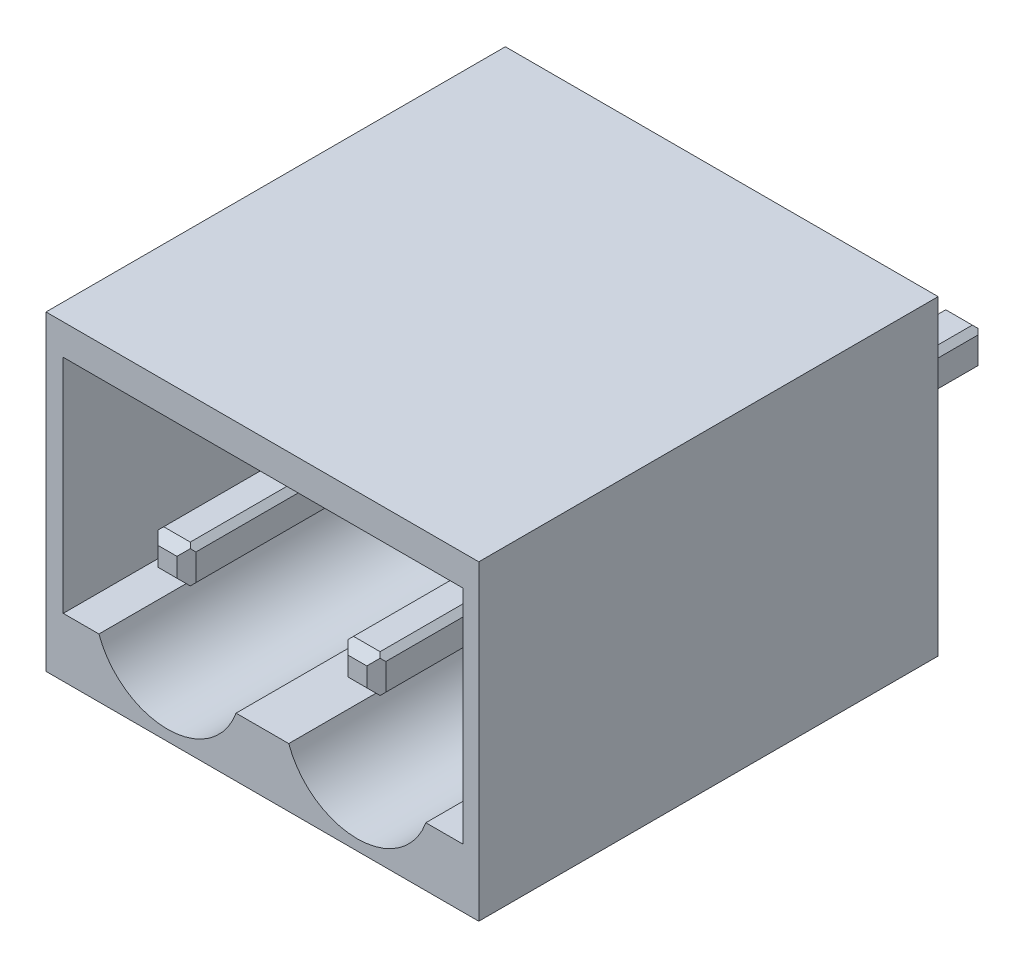
from build123d import *

# Parameters (mm, degrees)
SKETCH_1_W          = 11.4
SKETCH_1_H          = 8.2
EXTRUDE_1_DEPTH     = 12.1
SKETCH_4_R          = 1.25
CUT_EXTRUDE_3_DEPTH = 8
CUT_EXTRUDE_4_DEPTH = 7.8
SKETCH_7_W          = 1
SKETCH_7_H          = 1
EXTRUDE_2_DEPTH     = 8
CHAMFER_1_SIZE      = 0.15
CHAMFER_2_SIZE      = 0.25
SKETCH_9_W          = 1
SKETCH_9_H          = 1
EXTRUDE_4_DEPTH     = 4
CHAMFER_5_SIZE      = 0.15
CHAMFER_6_SIZE      = 0.25


with BuildPart() as part:
    # Эскиз1 → Бобышка-Вытянуть1 (new body)
    with BuildSketch(Plane.XY):
        Rectangle(SKETCH_1_W, SKETCH_1_H)
    extrude(amount=EXTRUDE_1_DEPTH)

    # Эскиз4 → Вырез-Вытянуть3 (cut)
    with BuildSketch(Plane.XY.offset(12.1)):
        with Locations((-2.5, 0)):
            Circle(SKETCH_4_R)
        with Locations((2.5, 0)):
            Circle(SKETCH_4_R)
    extrude(amount=-CUT_EXTRUDE_3_DEPTH, mode=Mode.SUBTRACT)

    # Эскиз5 → Вырез-Вытянуть4 (cut)
    with BuildSketch(Plane.XY.offset(12.1)):
        with BuildLine():
            Line((-5.245621634, 0), (-5.245621634, 3.292901982))
            Line((-5.245621634, 3.292901982), (5.278509544, 3.292901982))
            Line((5.278509544, 3.292901982), (5.278509544, -2.548957219))
            Line((5.278509544, -2.548957219), (4.30582632, -2.548957219))
            ThreePointArc((4.30582632, -2.548957219), (2.5, -3.818893996), (0.69417368, -2.548957219))
            Line((0.69417368, -2.548957219), (-0.69417368, -2.548957219))
            ThreePointArc((-0.69417368, -2.548957219), (-2.5, -3.818893996), (-4.30582632, -2.548957219))
            Line((-4.30582632, -2.548957219), (-5.245621634, -2.548957219))
            Line((-5.245621634, -2.548957219), (-5.245621634, 0))
        make_face()
    extrude(amount=-CUT_EXTRUDE_4_DEPTH, mode=Mode.SUBTRACT)

    # Эскиз7 → Бобышка-Вытянуть2 (add)
    with BuildSketch(Plane.XY.offset(4.1)):
        with Locations((2.5, 0)):
            Rectangle(SKETCH_7_W, SKETCH_7_H)
        with Locations((-2.5, 0)):
            Rectangle(SKETCH_7_W, SKETCH_7_H)
    extrude(amount=EXTRUDE_2_DEPTH)

    # Фаска1
    chamfer_1_edges = [part.edges().sort_by_distance(p)[0] for p in [
        (-2, -0.5, 8.1),
        (-2, 0.5, 8.1),
        (-3, 0.5, 8.1),
        (-3, -0.5, 8.1),
        (3, -0.5, 8.1),
        (3, 0.5, 8.1),
        (2, 0.5, 8.1),
        (2, -0.5, 8.1),
    ]]
    chamfer(chamfer_1_edges, length=CHAMFER_1_SIZE)

    # Фаска2
    # the kernel refuses this chamfer: 0.25 mm, written as the material it takes off along each edge
    with BuildSketch(Plane(origin=(2, -0.992920747, 12.1), x_dir=(-0.027495876610586414, 0, -0.9996219169112968), z_dir=(0, 1, 0)), Plane(origin=(1.507079253, 0.5, 12.1), x_dir=(0, 0.027495876610586414, -0.9996219169112968), z_dir=(1, 0, 0)), Plane(origin=(3, 0.992920747, 12.1), x_dir=(0.02749587661058555, 0, -0.9996219169112968), z_dir=(0, -1, 0)), Plane(origin=(3.492920747, -0.5, 12.1), x_dir=(0, -0.027495876610586414, -0.9996219169112968), z_dir=(-1, 0, 0)), Plane(origin=(-2, 0.992920747, 12.1), x_dir=(0.027495876610586414, 0, -0.9996219169112968), z_dir=(0, -1, 0)), Plane(origin=(-1.507079253, -0.5, 12.1), x_dir=(0, -0.027495876610586414, -0.9996219169112968), z_dir=(-1, 0, 0)), Plane(origin=(-3, -0.992920747, 12.1), x_dir=(-0.02749587661058555, 0, -0.9996219169112968), z_dir=(0, 1, 0)), Plane(origin=(-3.492920747, 0.5, 12.1), x_dir=(0, 0.027495876610586414, -0.9996219169112968), z_dir=(1, 0, 0))) as chamfer_2_piece_1:
        Polygon((CHAMFER_2_SIZE * 0.999621916911, -CHAMFER_2_SIZE * 0.0274958766106), (-CHAMFER_2_SIZE * 0.0274958766106, -CHAMFER_2_SIZE * 0.999621916911), (0, 0), align=None)
    extrude(amount=1.985841494, mode=Mode.SUBTRACT)

    # Эскиз9 → Бобышка-Вытянуть4 (add)
    with BuildSketch(Plane(origin=(0, 0, 0), x_dir=(-1, 0, 0), z_dir=(0, 0, -1))):
        with Locations((2.5, -0.35)):
            Rectangle(SKETCH_9_W, SKETCH_9_H)
        with Locations((-2.5, -0.35)):
            Rectangle(SKETCH_9_W, SKETCH_9_H)
    extrude(amount=EXTRUDE_4_DEPTH)

    # Фаска5
    chamfer_5_edges = [part.edges().sort_by_distance(p)[0] for p in [
        (2, -0.85, -2),
        (2, 0.15, -2),
        (3, 0.15, -2),
        (3, -0.85, -2),
        (-3, -0.85, -2),
        (-3, 0.15, -2),
        (-2, 0.15, -2),
        (-2, -0.85, -2),
    ]]
    chamfer(chamfer_5_edges, length=CHAMFER_5_SIZE)

    # Фаска6
    # the kernel refuses this chamfer: 0.25 mm, written as the material it takes off along each edge
    with BuildSketch(Plane(origin=(-3.492920747, -0.85, -4), x_dir=(0, -0.02749587661058651, 0.9996219169112968), z_dir=(1, 0, 0)), Plane(origin=(1.507079253, -0.85, -4), x_dir=(0, -0.02749587661058651, 0.9996219169112968), z_dir=(1, 0, 0)), Plane(origin=(3, -1.342920747, -4), x_dir=(0.027495876610585647, 0, 0.9996219169112968), z_dir=(0, 1, 0)), Plane(origin=(2, 0.642920747, -4), x_dir=(-0.02749587661058651, 0, 0.9996219169112968), z_dir=(0, -1, 0)), Plane(origin=(-2, -1.342920747, -4), x_dir=(0.02749587661058651, 0, 0.9996219169112968), z_dir=(0, 1, 0)), Plane(origin=(-3, 0.642920747, -4), x_dir=(-0.027495876610585647, 0, 0.9996219169112968), z_dir=(0, -1, 0)), Plane(origin=(-1.507079253, 0.15, -4), x_dir=(0, 0.027495876610586403, 0.9996219169112968), z_dir=(-1, 0, 0)), Plane(origin=(3.492920747, 0.15, -4), x_dir=(0, 0.027495876610586403, 0.9996219169112968), z_dir=(-1, 0, 0))) as chamfer_6_piece_1:
        Polygon((CHAMFER_6_SIZE * 0.999621916911, -CHAMFER_6_SIZE * 0.0274958766106), (-CHAMFER_6_SIZE * 0.0274958766106, -CHAMFER_6_SIZE * 0.999621916911), (0, 0), align=None)
    extrude(amount=1.985841494, mode=Mode.SUBTRACT)


solid = part.part
